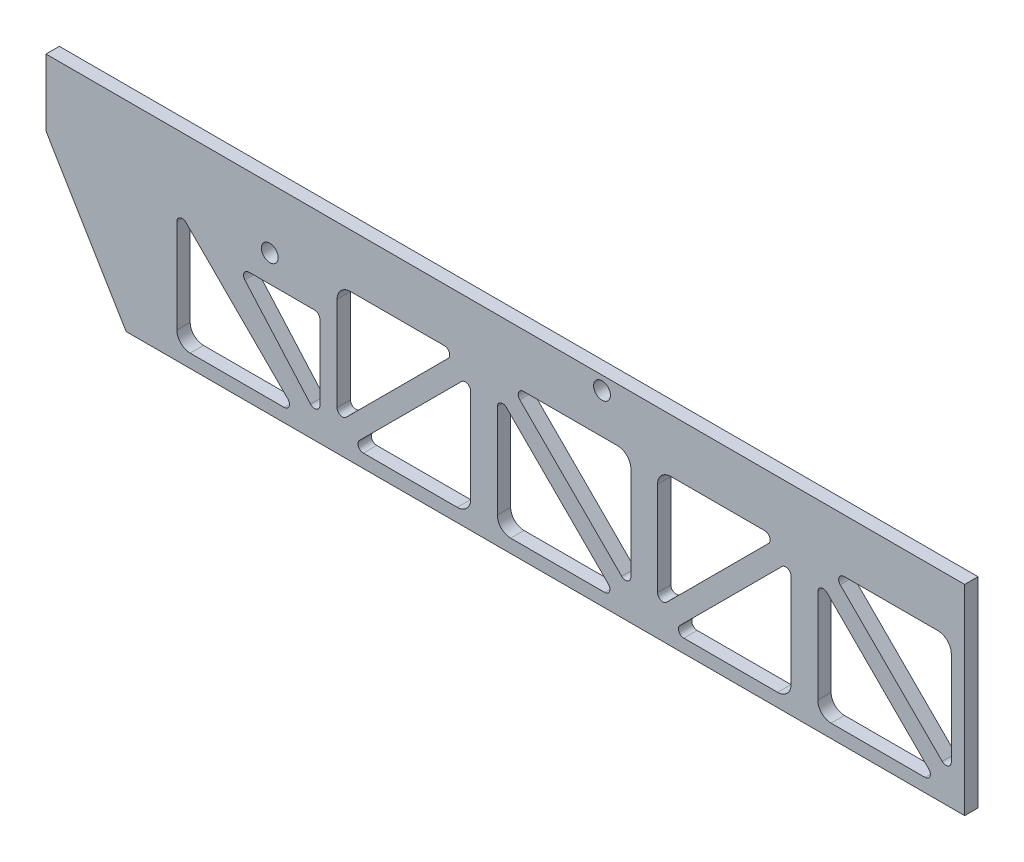
from build123d import *

# Parameters (mm, degrees)
MODEL_R             = 4
BOSS_EXTRUDE1_DEPTH = 6.35


with BuildPart() as part:
    # Model → Boss-Extrude1 (new body)
    with BuildSketch(Plane.XY):
        Polygon((-398.78, 0), (-436.88, 63.5), (-436.88, 95.25), (0, 95.25), (0, 0), align=None)
        with Locations((-172.466, 88.9)):
            Circle(MODEL_R, mode=Mode.SUBTRACT)
        with Locations((-330.454, 66.548)):
            Circle(MODEL_R, mode=Mode.SUBTRACT)
        with BuildLine():
            Line((-306.628052638, 15.624984002), (-306.628052638, 51.149330332))
            ThreePointArc((-306.628052638, 51.149330332), (-307.372001413, 52.945381557), (-309.168052638, 53.689330332))
            Line((-309.168052638, 53.689330332), (-340.406029433, 53.689330332))
            ThreePointArc((-340.406029433, 53.689330332), (-342.720322456, 52.196062295), (-342.31346603, 49.472045137))
            Line((-342.31346603, 49.472045137), (-311.075489235, 13.947698807))
            ThreePointArc((-311.075489235, 13.947698807), (-308.271751616, 13.248380443), (-306.628052638, 15.624984002))
        make_face(mode=Mode.SUBTRACT)
        with BuildLine():
            Line((-171.232102448, 6.35), (-215.9, 6.35))
            ThreePointArc((-215.9, 6.35), (-220.390128061, 8.209871939), (-222.25, 12.7))
            Line((-222.25, 12.7), (-222.25, 57.367897552))
            ThreePointArc((-222.25, 57.367897552), (-220.682015918, 59.714551564), (-217.913948776, 59.163948776))
            Line((-217.913948776, 59.163948776), (-169.436051224, 10.686051224))
            ThreePointArc((-169.436051224, 10.686051224), (-168.885448436, 7.917984082), (-171.232102448, 6.35))
        make_face(mode=Mode.SUBTRACT)
        with BuildLine():
            Line((-234.95, 57.367897552), (-234.95, 12.7))
            ThreePointArc((-234.95, 12.7), (-236.809871939, 8.209871939), (-241.3, 6.35))
            Line((-241.3, 6.35), (-285.967897552, 6.35))
            ThreePointArc((-285.967897552, 6.35), (-288.314551564, 7.917984082), (-287.763948776, 10.686051224))
            Line((-287.763948776, 10.686051224), (-239.286051224, 59.163948776))
            ThreePointArc((-239.286051224, 59.163948776), (-236.517984082, 59.714551564), (-234.95, 57.367897552))
        make_face(mode=Mode.SUBTRACT)
        with BuildLine():
            Line((-294.113948776, 17.036051224), (-245.636051224, 65.513948776))
            ThreePointArc((-245.636051224, 65.513948776), (-245.085448436, 68.282015918), (-247.432102448, 69.85))
            Line((-247.432102448, 69.85), (-292.1, 69.85))
            ThreePointArc((-292.1, 69.85), (-296.590128061, 67.990128061), (-298.45, 63.5))
            Line((-298.45, 63.5), (-298.45, 18.832102448))
            ThreePointArc((-298.45, 18.832102448), (-296.882015918, 16.485448436), (-294.113948776, 17.036051224))
        make_face(mode=Mode.SUBTRACT)
        with BuildLine():
            Line((-323.632102448, 6.35), (-368.3, 6.35))
            ThreePointArc((-368.3, 6.35), (-372.790128061, 8.209871939), (-374.65, 12.7))
            Line((-374.65, 12.7), (-374.65, 57.367897552))
            ThreePointArc((-374.65, 57.367897552), (-373.082015918, 59.714551564), (-370.313948776, 59.163948776))
            Line((-370.313948776, 59.163948776), (-321.836051224, 10.686051224))
            ThreePointArc((-321.836051224, 10.686051224), (-321.285448436, 7.917984082), (-323.632102448, 6.35))
        make_face(mode=Mode.SUBTRACT)
        with BuildLine():
            Line((-18.832102448, 6.35), (-63.5, 6.35))
            ThreePointArc((-63.5, 6.35), (-67.990128061, 8.209871939), (-69.85, 12.7))
            Line((-69.85, 12.7), (-69.85, 57.367897552))
            ThreePointArc((-69.85, 57.367897552), (-68.282015918, 59.714551564), (-65.513948776, 59.163948776))
            Line((-65.513948776, 59.163948776), (-17.036051224, 10.686051224))
            ThreePointArc((-17.036051224, 10.686051224), (-16.485448436, 7.917984082), (-18.832102448, 6.35))
        make_face(mode=Mode.SUBTRACT)
        with BuildLine():
            Line((-82.55, 57.367897552), (-82.55, 12.7))
            ThreePointArc((-82.55, 12.7), (-84.409871939, 8.209871939), (-88.9, 6.35))
            Line((-88.9, 6.35), (-133.567897552, 6.35))
            ThreePointArc((-133.567897552, 6.35), (-135.914551564, 7.917984082), (-135.363948776, 10.686051224))
            Line((-135.363948776, 10.686051224), (-86.886051224, 59.163948776))
            ThreePointArc((-86.886051224, 59.163948776), (-84.117984082, 59.714551564), (-82.55, 57.367897552))
        make_face(mode=Mode.SUBTRACT)
        with BuildLine():
            Line((-93.236051224, 65.513948776), (-141.713948776, 17.036051224))
            ThreePointArc((-141.713948776, 17.036051224), (-144.482015918, 16.485448436), (-146.05, 18.832102448))
            Line((-146.05, 18.832102448), (-146.05, 63.5))
            ThreePointArc((-146.05, 63.5), (-144.190128061, 67.990128061), (-139.7, 69.85))
            Line((-139.7, 69.85), (-95.032102448, 69.85))
            ThreePointArc((-95.032102448, 69.85), (-92.685448436, 68.282015918), (-93.236051224, 65.513948776))
        make_face(mode=Mode.SUBTRACT)
        with BuildLine():
            Line((-163.086051224, 17.036051224), (-211.563948776, 65.513948776))
            ThreePointArc((-211.563948776, 65.513948776), (-212.114551564, 68.282015918), (-209.767897552, 69.85))
            Line((-209.767897552, 69.85), (-165.1, 69.85))
            ThreePointArc((-165.1, 69.85), (-160.609871939, 67.990128061), (-158.75, 63.5))
            Line((-158.75, 63.5), (-158.75, 18.832102448))
            ThreePointArc((-158.75, 18.832102448), (-160.317984082, 16.485448436), (-163.086051224, 17.036051224))
        make_face(mode=Mode.SUBTRACT)
        with BuildLine():
            Line((-6.35, 63.5), (-6.35, 18.832102448))
            ThreePointArc((-6.35, 18.832102448), (-7.917984082, 16.485448436), (-10.686051224, 17.036051224))
            Line((-10.686051224, 17.036051224), (-59.163948776, 65.513948776))
            ThreePointArc((-59.163948776, 65.513948776), (-59.714551564, 68.282015918), (-57.367897552, 69.85))
            Line((-57.367897552, 69.85), (-12.7, 69.85))
            ThreePointArc((-12.7, 69.85), (-8.209871939, 67.990128061), (-6.35, 63.5))
        make_face(mode=Mode.SUBTRACT)
    extrude(amount=BOSS_EXTRUDE1_DEPTH)


solid = part.part
